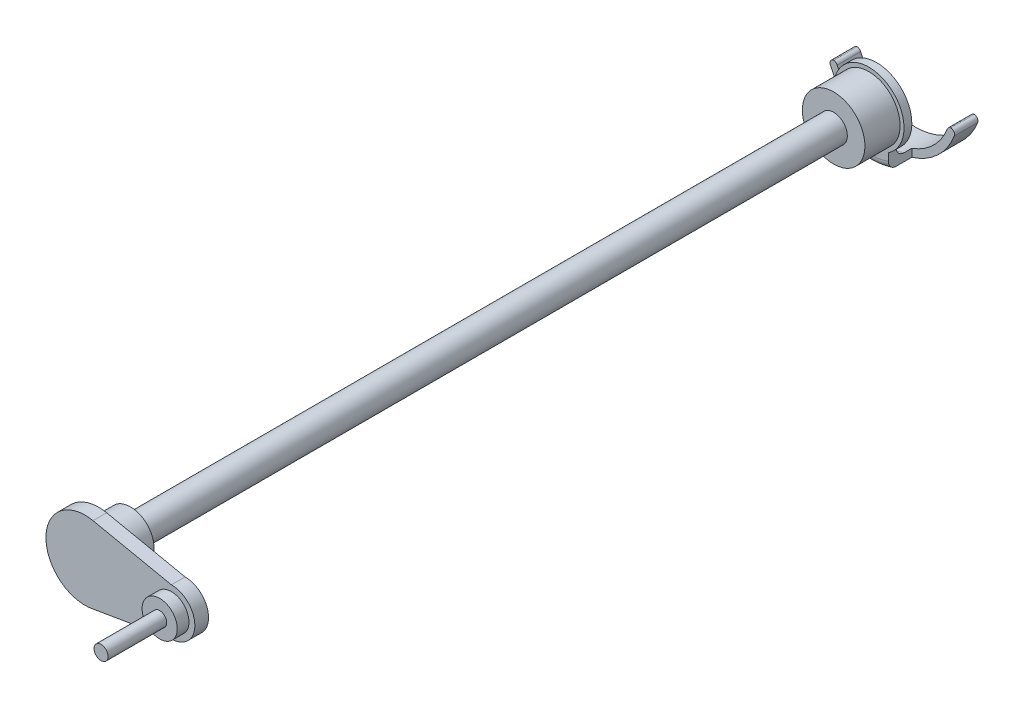
from build123d import *

# Parameters (mm, degrees)
CROQUIS1_R                   = 3.5
SALIENTE_EXTRUIR1_DEPTH      = 180
SALIENTE_EXTRUIR2_DEPTH      = 8
SALIENTE_EXTRUIR2_DEPTH_BACK = 1
CROQUIS2_R                   = 6
CROQUIS3_R                   = 10
SALIENTE_EXTRUIR3_DEPTH      = 3.5
SALIENTE_EXTRUIR4_START      = -3.5
SALIENTE_EXTRUIR4_DEPTH      = 3.5
CHAFL_N1_SIZE                = 1.5
CHAFL_N1_SIZE2               = 0.866025404
CROQUIS5_R                   = 8
SALIENTE_EXTRUIR5_DEPTH      = 9
CROQUIS6_R                   = 9
SALIENTE_EXTRUIR6_DEPTH      = 2
SALIENTE_EXTRUIR7_START      = -2
SALIENTE_EXTRUIR7_DEPTH      = 2
CROQUIS12_R                  = 4.5
SALIENTE_EXTRUIR11_DEPTH     = 3
CROQUIS13_R                  = 1.8
SALIENTE_EXTRUIR12_DEPTH     = 15
CROQUIS18_W                  = 10
CROQUIS18_H                  = 2
SALIENTE_EXTRUIR16_DEPTH     = 4
SALIENTE_EXTRUIR17_DEPTH     = 6
CORTAR_EXTRUIR3_START        = -4
CORTAR_EXTRUIR3_DEPTH        = 4
SALIENTE_EXTRUIR18_START     = 6
SALIENTE_EXTRUIR18_DEPTH     = 6
REDONDEO7_R                  = 2
REDONDEO8_R                  = 1


with BuildPart() as part:
    # Croquis1 → Saliente-Extruir1 (new body)
    with BuildSketch(Plane.XY):
        with Locations(Location((0, 0, 0), (0, 0, 180))):
            Circle(CROQUIS1_R)
    extrude(amount=SALIENTE_EXTRUIR1_DEPTH)

    # Croquis2 → Saliente-Extruir2 (add, two sides: drawn at the far end of the back side and taken through both)
    with BuildSketch(Plane.XY.offset(180).offset(-SALIENTE_EXTRUIR2_DEPTH_BACK)):
        Circle(CROQUIS2_R)
    extrude(amount=SALIENTE_EXTRUIR2_DEPTH + SALIENTE_EXTRUIR2_DEPTH_BACK)

    # Croquis3 → Saliente-Extruir3 (add)
    with BuildSketch(Plane.XY.offset(188)):
        Circle(CROQUIS3_R)
    extrude(amount=SALIENTE_EXTRUIR3_DEPTH)

    # Croquis4 → Saliente-Extruir4 (add)
    with BuildSketch(Plane.XY.offset(191.5).offset(SALIENTE_EXTRUIR4_START)):
        with BuildLine():
            Line((2.043748165, 9.788927083), (22.095380186, 5.602514639))
            ThreePointArc((22.095380186, 5.602514639), (28.095380186, -0.397485361), (22.095380186, -6.397485361))
            Line((22.095380186, -6.397485361), (2.043748165, -9.788927083))
            ThreePointArc((2.043748165, -9.788927083), (10, 0), (2.043748165, 9.788927083))
        make_face()
    extrude(amount=SALIENTE_EXTRUIR4_DEPTH)

    # Chaflán1
    chafl_n1_edges = [part.edges().sort_by_distance(p)[0] for p in [
        (-6, 0, 179),
    ]]
    chafl_n1_side = [part.faces().sort_by_distance(p)[0] for p in [
        (-5.830294373, 0, 179),
    ]]
    chamfer(chafl_n1_edges, length=CHAFL_N1_SIZE, length2=CHAFL_N1_SIZE2, reference=chafl_n1_side[0])

    # Croquis5 → Saliente-Extruir5 (add)
    with BuildSketch(Plane(origin=(0, 0, 0), x_dir=(-1, 0, 0), z_dir=(0, 0, -1))):
        Circle(CROQUIS5_R)
    extrude(amount=SALIENTE_EXTRUIR5_DEPTH)

    # Croquis6 → Saliente-Extruir6 (add)
    with BuildSketch(Plane(origin=(0, 0, -9), x_dir=(-1, 0, 0), z_dir=(0, 0, -1))):
        Circle(CROQUIS6_R)
    extrude(amount=SALIENTE_EXTRUIR6_DEPTH)

    # Croquis7 → Saliente-Extruir7 (add)
    with BuildSketch(Plane(origin=(0, 0, -11), x_dir=(-1, 0, 0), z_dir=(0, 0, -1)).offset(SALIENTE_EXTRUIR7_START)):
        with BuildLine():
            Line((-5, -7.483314774), (-5, -11.483314774))
            Line((-5, -11.483314774), (5, -11.483314774))
            Line((5, -11.483314774), (5, -7.483314774))
            ThreePointArc((5, -7.483314774), (0, -9), (-5, -7.483314774))
        make_face()
    extrude(amount=SALIENTE_EXTRUIR7_DEPTH)

    # Croquis12 → Saliente-Extruir11 (add)
    with BuildSketch(Plane.XY.offset(191.5)):
        with Locations((22.095380186, -0.397485361)):
            Circle(CROQUIS12_R)
    extrude(amount=SALIENTE_EXTRUIR11_DEPTH)

    # Croquis13 → Saliente-Extruir12 (add)
    with BuildSketch(Plane.XY.offset(194.5)):
        with Locations((22.095380186, -0.397485361)):
            Circle(CROQUIS13_R)
    extrude(amount=SALIENTE_EXTRUIR12_DEPTH)

    # Croquis18 → Saliente-Extruir16 (add)
    with BuildSketch(Plane(origin=(0, 0, -11), x_dir=(-1, 0, 0), z_dir=(0, 0, -1))):
        with Locations((0, -10.483314774)):
            Rectangle(CROQUIS18_W, CROQUIS18_H)
    extrude(amount=SALIENTE_EXTRUIR16_DEPTH)

    # Croquis19 → Saliente-Extruir17 (add)
    with BuildSketch(Plane(origin=(0, 0, -15), x_dir=(-1, 0, 0), z_dir=(0, 0, -1))):
        with BuildLine():
            Line((14.328458937, 0), (16.318610319, 0))
            ThreePointArc((16.318610319, 0), (0, -12.235237964), (-16.318610319, 0))
            Line((-16.318610319, 0), (-14.328458937, 0))
            ThreePointArc((-14.328458937, 0), (0, -10.335161566), (14.328458937, 0))
        make_face()
    extrude(amount=SALIENTE_EXTRUIR17_DEPTH)

    # Croquis20 → Cortar-Extruir3 (cut)
    with BuildSketch(Plane(origin=(0, 0, -15), x_dir=(-1, 0, 0), z_dir=(0, 0, -1)).offset(CORTAR_EXTRUIR3_START)):
        with BuildLine():
            Line((5, -9.483314774), (-5, -9.483314774))
            ThreePointArc((-5, -9.483314774), (0, -10.335161566), (5, -9.483314774))
        make_face()
    extrude(amount=CORTAR_EXTRUIR3_DEPTH, mode=Mode.SUBTRACT)

    # Croquis21 → Saliente-Extruir18 (add)
    with BuildSketch(Plane.XY.offset(-15).offset(SALIENTE_EXTRUIR18_START)):
        with BuildLine():
            Line((5, -11.483314774), (-5, -11.483314774))
            ThreePointArc((-5, -11.483314774), (0, -12.235237964), (5, -11.483314774))
        make_face()
    extrude(amount=-SALIENTE_EXTRUIR18_DEPTH)

    # Redondeo7
    redondeo7_edges = [part.edges().sort_by_distance(p)[0] for p in [
        (0, -12.235237964, -9),
        (0, -10.335161566, -11),
    ]]
    fillet(redondeo7_edges, radius=REDONDEO7_R)

    # Redondeo8
    # the kernel refuses this fillet: 1 mm, written as the material it takes off along each edge
    with BuildSketch(Plane(origin=(-16.318610319, 0, -11.409775172), x_dir=(0.3205749609840578, -0.9472231492051225, 0), z_dir=(0, 0, -1))) as redondeo8_piece_1:
        with BuildLine():
            CenterArc((1.393851992, -0.99910758), REDONDEO8_R, 87.579224192, 111.118475452)
            Line((0.446628843, -1.319682541), (0, 0))
            ThreePointArc((0, 0), (0.718044966, 0.015171139), (1.436089931, 0))
        make_face()
    extrude(amount=13.180449656, mode=Mode.SUBTRACT)
    with BuildSketch(Plane(origin=(-14.328458937, 0, -13.239980297), x_dir=(0.3368909660560179, -0.9415436670648064, 0), z_dir=(0, 0, -1))) as redondeo8_piece_2:
        with BuildLine():
            CenterArc((0.704369772, 0.999745128), REDONDEO8_R, 199.687567709, 69.018809156)
            Line((-0.237173895, 0.662854162), (0, 0))
            ThreePointArc((0, 0), (0.340896854, 0.003848545), (0.681793707, 0))
        make_face()
    extrude(amount=9.520039406, mode=Mode.SUBTRACT)
    with BuildSketch(Plane(origin=(16.318610319, 0, -11.409775172), x_dir=(-0.3205749609840585, -0.9472231492051224, 0), z_dir=(0, 0, -1))) as redondeo8_piece_3:
        with BuildLine():
            CenterArc((1.393851992, 0.99910758), REDONDEO8_R, 161.302300356, 111.118475452)
            Line((0.446628843, 1.319682541), (0, 0))
            ThreePointArc((0, 0), (0.718044966, -0.015171139), (1.436089931, 0))
        make_face()
    extrude(amount=13.180449656, mode=Mode.SUBTRACT)
    with BuildSketch(Plane(origin=(14.328458937, 0, -13.239980297), x_dir=(-0.33689096605601593, -0.9415436670648072, 0), z_dir=(0, 0, -1))) as redondeo8_piece_4:
        with BuildLine():
            CenterArc((0.704369772, -0.999745128), REDONDEO8_R, 91.293623135, 69.018809156)
            Line((-0.237173895, -0.662854162), (0, 0))
            ThreePointArc((0, 0), (0.340896854, -0.003848545), (0.681793707, 0))
        make_face()
    extrude(amount=9.520039406, mode=Mode.SUBTRACT)


solid = part.part
